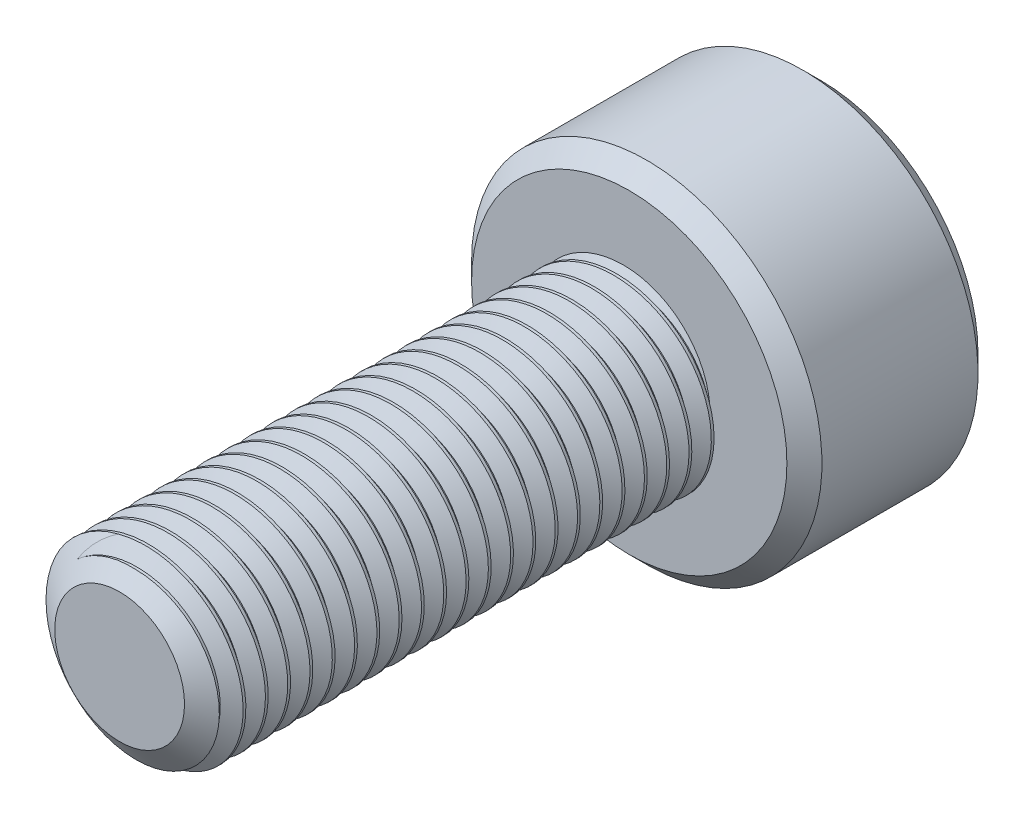
from build123d import *

# Parameters (mm, degrees)
SKETCH1_R          = 1.5
EXTRUDE1_DEPTH     = 8
CUT_SWEEP1_PITCH   = 0.35
SKETCH6_R          = 2.75
EXTRUDE2_DEPTH     = 3
CUT_EXTRUDE1_DEPTH = 1.875
CHAMFER1_SIZE      = 0.275


with BuildPart() as part:
    # Sketch1 → Extrude1 (new body)
    with BuildSketch(Plane.XY):
        Circle(SKETCH1_R)
    extrude(amount=-EXTRUDE1_DEPTH)

    # Cut-Sweep1: the profile of Sketch3 profile screwed along a right-hand helix of 23.857143 turns, 6 arcs to a turn; built about Z, then put on its axis
    cut_sweep1_z = Axis((0, 0, 0), (0, 0, 1))
    cut_sweep1_corners = [(1.5003, 0, -0.306423205), (1.272668332, 0, -0.175), (1.272668332, 0, -0.13125), (1.5003, 0, 0.000173205)]
    with BuildLine(mode=Mode.PRIVATE) as cut_sweep1_profile:
        Line(cut_sweep1_corners[0], cut_sweep1_corners[1])
        Line(cut_sweep1_corners[1], cut_sweep1_corners[2])
        Line(cut_sweep1_corners[2], cut_sweep1_corners[3])
        Line(cut_sweep1_corners[3], cut_sweep1_corners[0])
    cut_sweep1_cap = Face(cut_sweep1_profile.wire())
    cut_sweep1_turn_angles = [0, 30, 60, 90, 120, 150, 180, 210, 240, 270, 300, 330, 360]
    cut_sweep1_turn_weights = [1, 0.8660254037844387, 1, 0.8660254037844387, 1, 0.8660254037844387, 1, 0.8660254037844387, 1, 0.8660254037844387, 1, 0.8660254037844387, 1]
    cut_sweep1_turn_rails = [Edge.make_bspline([Vector(p[0], p[1], 0).rotate(cut_sweep1_z, cut_sweep1_turn_angles[k]) / cut_sweep1_turn_weights[k] + Vector(0, 0, p[2] + CUT_SWEEP1_PITCH * cut_sweep1_turn_angles[k] / 360) for k in range(13)], [0, 0, 0, 1, 1, 2, 2, 3, 3, 4, 4, 5, 5, 6, 6, 6], 2, cut_sweep1_turn_weights) for p in cut_sweep1_corners]
    cut_sweep1_turn_sides = [Face.make_surface_from_curves(cut_sweep1_turn_rails[p[0]], cut_sweep1_turn_rails[p[1]]) for p in [(0, 1), (1, 2), (2, 3), (3, 0)]]
    cut_sweep1_last_angles = [8280, 8310, 8340, 8370, 8400, 8430, 8460, 8490, 8520, 8550, 8580, 8584.285714286, 8588.571428571]
    cut_sweep1_last_weights = [1, 0.8660254037844387, 1, 0.8660254037844387, 1, 0.8660254037844387, 1, 0.8660254037844387, 1, 0.8660254037844387, 1, 0.997203797181201, 1]
    cut_sweep1_last_rails = [Edge.make_bspline([Vector(p[0], p[1], 0).rotate(cut_sweep1_z, cut_sweep1_last_angles[k]) / cut_sweep1_last_weights[k] + Vector(0, 0, p[2] + CUT_SWEEP1_PITCH * cut_sweep1_last_angles[k] / 360) for k in range(13)], [0, 0, 0, 1, 1, 2, 2, 3, 3, 4, 4, 5, 5, 6, 6, 6], 2, cut_sweep1_last_weights) for p in cut_sweep1_corners]
    cut_sweep1_last_sides = [Face.make_surface_from_curves(cut_sweep1_last_rails[p[0]], cut_sweep1_last_rails[p[1]]) for p in [(0, 1), (1, 2), (2, 3), (3, 0)]]
    cut_sweep1 = Plane(origin=(0, 0, 0), x_dir=(0, 1, 0), z_dir=(0, 0, -1)) * Solid(Shell([*[p.moved(Location((0, 0, CUT_SWEEP1_PITCH * i))) for i in range(23) for p in cut_sweep1_turn_sides], *cut_sweep1_last_sides, cut_sweep1_cap, cut_sweep1_cap.rotate(cut_sweep1_z, 8588.571428571).moved(Location((0, 0, CUT_SWEEP1_PITCH * 8588.571428571 / 360)))]))
    add(cut_sweep1, mode=Mode.SUBTRACT)

    # Sketch4 → Cut-Revolve1 (revolve, cut)
    with BuildSketch(Plane(origin=(0, 0, 0), x_dir=(0, 0, -1), z_dir=(1, 0, 0)), mode=Mode.PRIVATE) as cut_revolve1_sk:
        Polygon((0.337032063, 1.5), (0, 1.018668332), (0, 1.5), align=None)
    revolve(cut_revolve1_sk.sketch.rotate(Axis((0, 0, 0), (0, 0, -1)), 301.815814274), axis=Axis((0, 0, 0), (0, 0, -1)), mode=Mode.SUBTRACT)

    # Sketch6 → Extrude2 (add)
    with BuildSketch(Plane(origin=(0, 0, -8), x_dir=(-1, 0, 0), z_dir=(0, 0, -1))):
        Circle(SKETCH6_R)
    extrude(amount=EXTRUDE2_DEPTH)

    # Sketch7 → Cut-Extrude1 (cut)
    with BuildSketch(Plane(origin=(0, 0, -11), x_dir=(-1, 0, 0), z_dir=(0, 0, -1))):
        Polygon((0, 1.443375673), (-1.25, 0.721687836), (-1.25, -0.721687836), (0, -1.443375673), (1.25, -0.721687836), (1.25, 0.721687836), align=None)
    extrude(amount=-CUT_EXTRUDE1_DEPTH, mode=Mode.SUBTRACT)

    # Cut-Extrude2 cone 1 section (through the dimple's axis) → Cut-Extrude2 (revolve, cut)
    with BuildSketch(Plane(origin=(0, 0, -11), x_dir=(0, 1, 0), z_dir=(1, 0, 0))):
        Polygon((0, 0), (1.443375673, 0), (0, 1.443375673), align=None)
    revolve(axis=Axis((0, 0, -11), (0, 0, 1)), mode=Mode.SUBTRACT)

    # Chamfer1
    chamfer1_edges = [part.edges().sort_by_distance(p)[0] for p in [
        (2.75, 0, -8),
        (2.75, 0, -11),
    ]]
    chamfer(chamfer1_edges, length=CHAMFER1_SIZE)


solid = part.part
